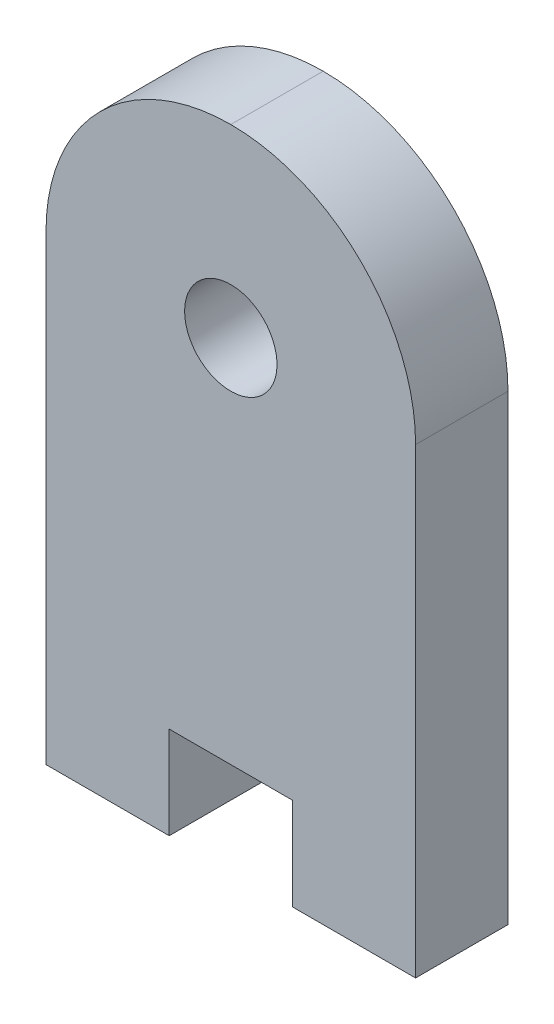
from build123d import *

# Parameters (mm, degrees)
SKETCH1_W           = 20
SKETCH1_H           = 30
BOSS_EXTRUDE1_DEPTH = 5
FILLET2_R           = 10
SKETCH2_R           = 2.5
CUT_EXTRUDE1_DEPTH  = 19.708286934
SKETCH3_W           = 6.666666667
SKETCH3_H           = 5
BOSS_EXTRUDE2_DEPTH = 5


with BuildPart() as part:
    # Sketch1 → Boss-Extrude1 (new body)
    with BuildSketch(Plane.XY):
        Rectangle(SKETCH1_W, SKETCH1_H)
    extrude(amount=BOSS_EXTRUDE1_DEPTH)

    # Fillet2
    fillet2_edges = [part.edges().sort_by_distance(p)[0] for p in [
        (-10, 15, 2.5),
        (10, 15, 2.5),
    ]]
    fillet(fillet2_edges, radius=FILLET2_R - 0.0001)  # a hair under: the kernel refuses the full size

    # Sketch2 → Cut-Extrude1 (cut, through all)
    with BuildSketch(Plane(origin=(0, 0, 0), x_dir=(-1, 0, 0), z_dir=(0, 0, -1))):
        with Locations((0, 5)):
            Circle(SKETCH2_R)
    extrude(amount=-CUT_EXTRUDE1_DEPTH, mode=Mode.SUBTRACT)

    # Sketch3 → Boss-Extrude2 (add)
    with BuildSketch(Plane.XZ.offset(15)):
        with Locations((-6.666666667, 2.5)):
            Rectangle(SKETCH3_W, SKETCH3_H)
        with Locations((6.666666667, 2.5)):
            Rectangle(SKETCH3_W, SKETCH3_H)
    extrude(amount=BOSS_EXTRUDE2_DEPTH)


solid = part.part
